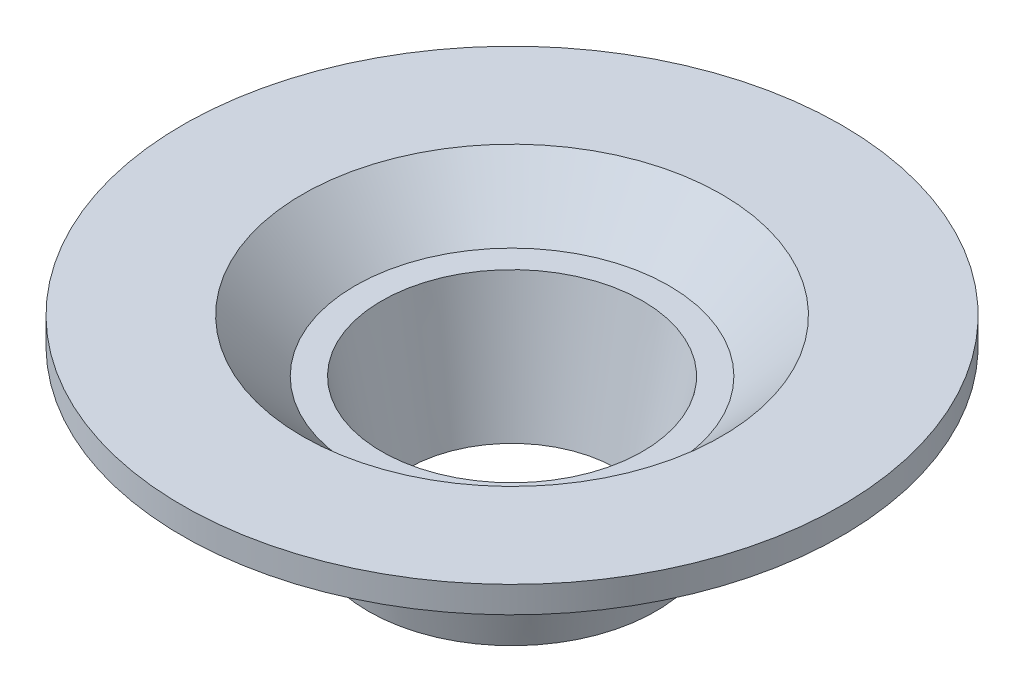
from build123d import *


with BuildPart() as part:
    # Sketch1 → Revolve1 (revolve)
    with BuildSketch(Plane.XY):
        Polygon((4.95, 5), (5.95, 5), (7.95, 7), (12.5, 7), (12.5, 6), (10.5, 6), (8.5, 4), (6.25, 4), (5.45, 0), (3.95, 0), align=None)
    revolve(axis=Axis((0, 0, 0), (0, 1, 0)))


solid = part.part
